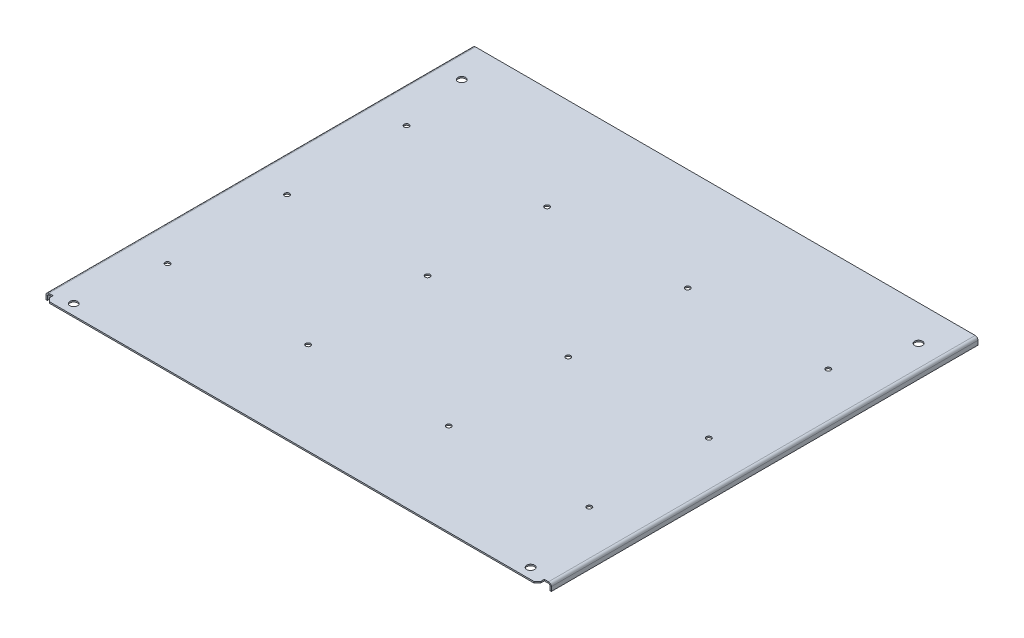
from build123d import *

# Parameters (mm, degrees)
SM_BASE_FLANGE_1_DEPTH = 308.5
SKETCH_6_W             = 10
SKETCH_6_H             = 10
CUT_EXTRUDE_1_DEPTH    = 474.827500257
OTHER_1_DEPTH          = 2
SKETCH_7_R             = 5.5
CUT_EXTRUDE_2_DEPTH    = 10
SKETCH_8_R             = 3.5
CUT_EXTRUDE_3_DEPTH    = 10


# Read off the part's stored shape, not the designer's step: Затупленный угол1
# Sheet-metal steps are written as plain solids
with BuildPart() as part:
    # Sketch 1 → Базовая кромка1 (new, symmetric)
    with BuildSketch(Plane.XY):
        with BuildLine():
            Line((-357.5, -8), (-357.5, -2))
            ThreePointArc((-357.5, -2), (-356.914213562, -0.585786438), (-355.5, 0))
            Line((-355.5, 0), (355.5, 0))
            ThreePointArc((355.5, 0), (356.914213562, -0.585786438), (357.5, -2))
            Line((357.5, -2), (357.5, -8))
            Line((357.5, -8), (359.5, -8))
            Line((359.5, -8), (359.5, -2))
            ThreePointArc((359.5, -2), (358.328427125, 0.828427125), (355.5, 2))
            Line((355.5, 2), (-355.5, 2))
            ThreePointArc((-355.5, 2), (-358.328427125, 0.828427125), (-359.5, -2))
            Line((-359.5, -2), (-359.5, -8))
            Line((-359.5, -8), (-357.5, -8))
        make_face()
    extrude(amount=SM_BASE_FLANGE_1_DEPTH, both=True)

    # Эскиз6 → Вырез-Вытянуть1 (cut, through all)
    with BuildSketch(Plane(origin=(0, 2, 0), x_dir=(1, 0, 0), z_dir=(0, 1, 0))):
        with Locations((-354.5, -303.5)):
            Rectangle(SKETCH_6_W, SKETCH_6_H)
        with Locations((354.5, -303.5)):
            Rectangle(SKETCH_6_W, SKETCH_6_H)
    extrude(amount=-CUT_EXTRUDE_1_DEPTH, mode=Mode.SUBTRACT)

    # Other 1 outline → Other 1 (cut)
    with BuildSketch(Plane(origin=(0, 0, 0), x_dir=(1, 0, 0), z_dir=(0, 1, 0))):
        Polygon((-349.5, -308.5), (-344.5, -308.5), (-349.5, -303.5), align=None)
        Polygon((349.5, -303.5), (344.5, -308.5), (349.5, -308.5), align=None)
    extrude(amount=OTHER_1_DEPTH, mode=Mode.SUBTRACT)

    # Эскиз7 → Вырез-Вытянуть2 (cut)
    with BuildSketch(Plane(origin=(0, 2, 0), x_dir=(1, 0, 0), z_dir=(0, 1, 0))):
        with Locations(Location((325, -293.5, 0), (0, 0, 270))):
            Circle(SKETCH_7_R)
        with Locations(Location((-325, -293.5, 0), (0, 0, 270))):
            Circle(SKETCH_7_R)
        with Locations(Location((-325, 258.5, 0), (0, 0, 270))):
            Circle(SKETCH_7_R)
        with Locations(Location((325, 258.5, 0), (0, 0, 270))):
            Circle(SKETCH_7_R)
    extrude(amount=-CUT_EXTRUDE_2_DEPTH, mode=Mode.SUBTRACT)

    # Эскиз8 → Вырез-Вытянуть3 (cut)
    with BuildSketch(Plane(origin=(0, 2, 0), x_dir=(1, 0, 0), z_dir=(0, 1, 0))):
        with Locations(Location((292.5, 162.5, 0), (0, 0, 270))):
            Circle(SKETCH_8_R)
        with Locations(Location((92.5, 162.5, 0), (0, 0, 270))):
            Circle(SKETCH_8_R)
        with Locations(Location((-107.5, 162.5, 0), (0, 0, 270))):
            Circle(SKETCH_8_R)
        with Locations(Location((-307.5, 162.5, 0), (0, 0, 270))):
            Circle(SKETCH_8_R)
        with Locations(Location((92.5, -7.5, 0), (0, 0, 270))):
            Circle(SKETCH_8_R)
        with Locations(Location((-107.5, -7.5, 0), (0, 0, 270))):
            Circle(SKETCH_8_R)
        with Locations(Location((-307.5, -7.5, 0), (0, 0, 270))):
            Circle(SKETCH_8_R)
        with Locations(Location((92.5, -177.5, 0), (0, 0, 270))):
            Circle(SKETCH_8_R)
        with Locations(Location((-107.5, -177.5, 0), (0, 0, 270))):
            Circle(SKETCH_8_R)
        with Locations(Location((-307.5, -177.5, 0), (0, 0, 270))):
            Circle(SKETCH_8_R)
        with Locations(Location((292.5, -7.5, 0), (0, 0, 270))):
            Circle(SKETCH_8_R)
        with Locations(Location((292.5, -177.5, 0), (0, 0, 270))):
            Circle(SKETCH_8_R)
    extrude(amount=-CUT_EXTRUDE_3_DEPTH, mode=Mode.SUBTRACT)


solid = part.part
